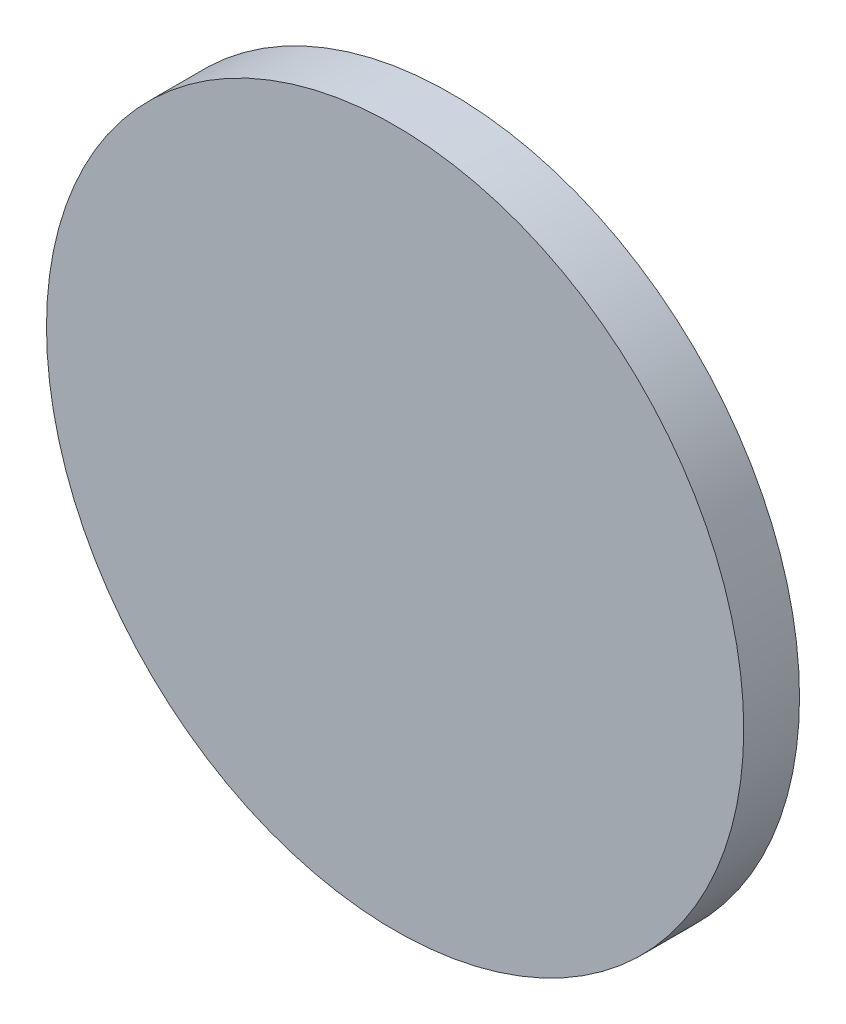
from build123d import *

# Parameters (mm, degrees)
SKETCH1_R           = 12.5
BOSS_EXTRUDE1_DEPTH = 2


with BuildPart() as part:
    # Sketch1 → Boss-Extrude1 (new body)
    with BuildSketch(Plane.XY):
        Circle(SKETCH1_R)
    extrude(amount=BOSS_EXTRUDE1_DEPTH)


solid = part.part
